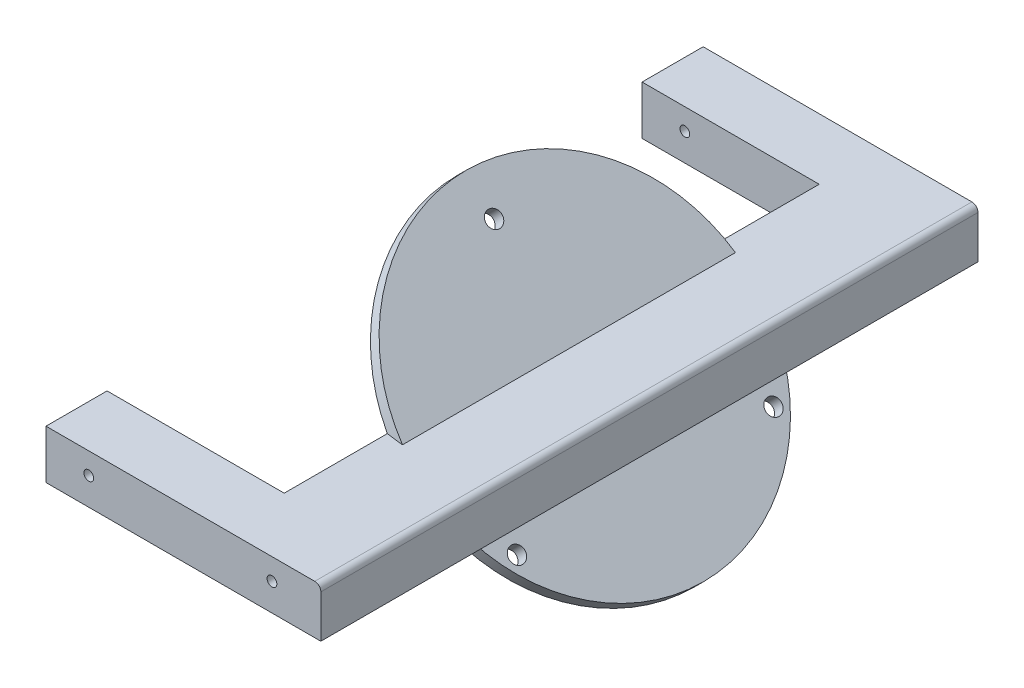
from build123d import *

# Parameters (mm, degrees)
BASE_DEPTH                  = 53.8
SKETCH4_R                   = 27.5
BOSS_EXTRUDE2_DEPTH         = 2
M2_CLEARANCE_HOLE2_D        = 2.6
FILLET1_R                   = 0.5
SIDE_HOLES_D                = 1.6
SIDE_ARM_DEPTH              = 10
TAP_DRILL_FOR_M2X0_4_TAP1_D = 1.6
FILLET2_R                   = 1


with BuildPart() as part:
    # Sketch1 → Base (new, symmetric)
    with BuildSketch(Plane.XY):
        Polygon((8, 4), (-8, 4), (0, -4), (8, -4), align=None)
    extrude(amount=BASE_DEPTH, both=True)

    # Sketch4 → Boss-Extrude2 (add)
    with BuildSketch(Plane(origin=(-2, -2, 0), x_dir=(0, 0, 1), z_dir=(-0.7071067811865475, -0.7071067811865476, 0))):
        with Locations((0, 2.828427125)):
            Circle(SKETCH4_R)
    extrude(amount=-BOSS_EXTRUDE2_DEPTH)

    # M2 Clearance Hole2 (through all)
    with Locations(Plane(origin=(-0.585786438, -0.585786438, 0), x_dir=(0.7071067811865475, -0.7071067811865477, 0), z_dir=(0.7071067811865477, 0.7071067811865475, 0))):
        with Locations((-23.828427125, 0), (11.171572875, 21), (11.171572875, -21)):
            Hole(M2_CLEARANCE_HOLE2_D / 2)

    # Sketch8 → Revolve1 (revolve)
    with BuildSketch(Plane(origin=(-2, 2, 0), x_dir=(0, 0, 1), z_dir=(0.7071067811865437, -0.7071067811865515, 0))):
        with BuildLine():
            Line((0, 3.828427125), (0, 2.828427125))
            Line((0, 2.828427125), (-12, 2.828427125))
            Line((-12, 2.828427125), (-6.5, 10.328427125))
            ThreePointArc((-6.5, 10.328427125), (-4.596194078, 5.732233047), (0, 3.828427125))
        make_face()
    revolve(axis=Axis((-4, 0, 0), (-0.7071067811865515, -0.7071067811865437, 0)))

    # Fillet1
    fillet1_edges = [part.edges().sort_by_distance(p)[0] for p in [
        (-9.303300859, -5.303300859, 6.5),
    ]]
    fillet(fillet1_edges, radius=FILLET1_R)

    # Side Holes (through all)
    with Locations(Plane.XY.offset(53.8)):
        with Locations((0, 0.5)):
            Hole(SIDE_HOLES_D / 2)

    # Sketch9 → Side Arm (add)
    with BuildSketch(Plane.XY.offset(53.8)):
        Polygon((-8, 4), (0, -4), (-37, -4), (-37, 4), align=None)
    side_arm = extrude(amount=-SIDE_ARM_DEPTH)

    # Mirror1: Side Arm across plane
    add(side_arm.mirror(Plane.XY))

    # Tap Drill for M2x0.4 Tap1 (through all)
    with Locations(Plane.XY.offset(53.8)):
        with Locations((-30, 0.5)):
            Hole(TAP_DRILL_FOR_M2X0_4_TAP1_D / 2)

    # Fillet2
    fillet2_edges = [part.edges().sort_by_distance(p)[0] for p in [
        (8, 4, 0),
    ]]
    fillet(fillet2_edges, radius=FILLET2_R)


solid = part.part
